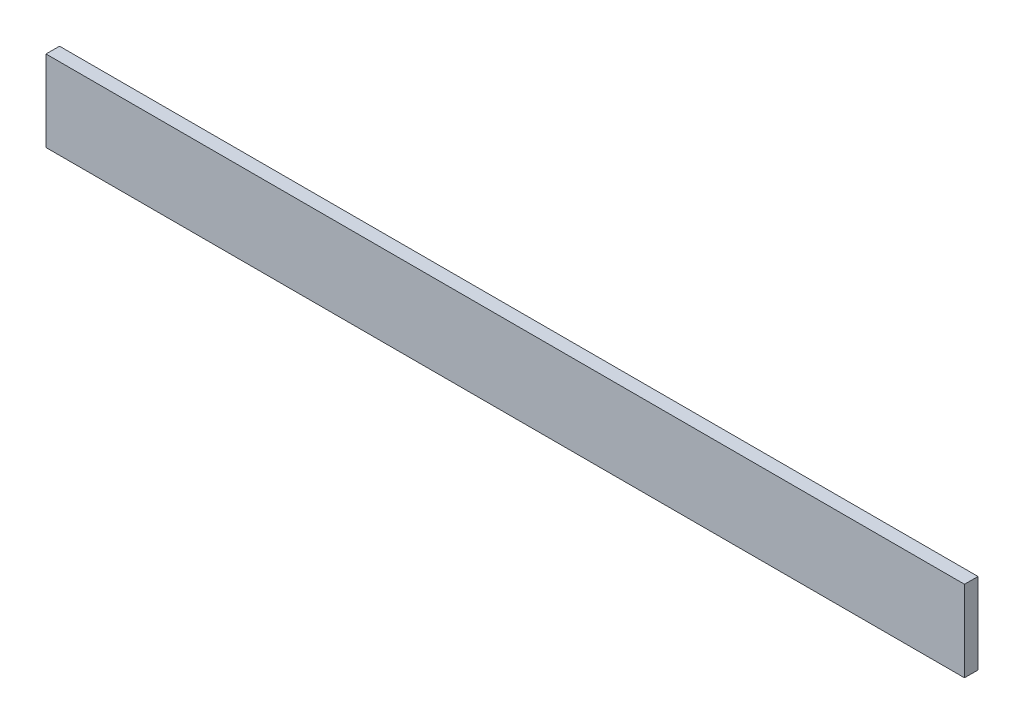
from build123d import *

# Parameters (mm, degrees)
SKETCH1_W           = 431.8
SKETCH1_H           = 38.1
BOSS_EXTRUDE1_DEPTH = 6.35


with BuildPart() as part:
    # Sketch1 → Boss-Extrude1 (new body)
    with BuildSketch(Plane.XY):
        with Locations((215.9, 19.05)):
            Rectangle(SKETCH1_W, SKETCH1_H)
    extrude(amount=BOSS_EXTRUDE1_DEPTH)


solid = part.part
